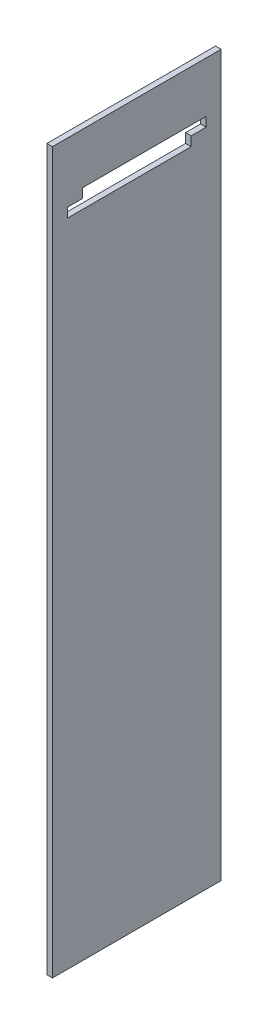
from build123d import *

# Parameters (mm, degrees)
SKETCH1_W           = 4.7625
SKETCH1_H           = 142.875
BOSS_EXTRUDE1_DEPTH = 609.6
CUT_EXTRUDE2_DEPTH  = 627.13745059


with BuildPart() as part:
    # Sketch1 → Boss-Extrude1 (new body)
    with BuildSketch(Plane(origin=(0, 0, 0), x_dir=(1, 0, 0), z_dir=(0, 1, 0))):
        with Locations((2.38125, 71.4375)):
            Rectangle(SKETCH1_W, SKETCH1_H)
    extrude(amount=BOSS_EXTRUDE1_DEPTH)

    # Sketch4 → Cut-Extrude2 (cut, through all)
    with BuildSketch(Plane.ZY):
        Polygon((-117.475, 550.8625), (-12.7, 550.8625), (-12.7, 558.8), (-25.4, 558.8), (-25.4, 566.7375), (-130.175, 566.7375), (-130.175, 558.8), (-117.475, 558.8), align=None)
    extrude(amount=-CUT_EXTRUDE2_DEPTH, mode=Mode.SUBTRACT)


solid = part.part
